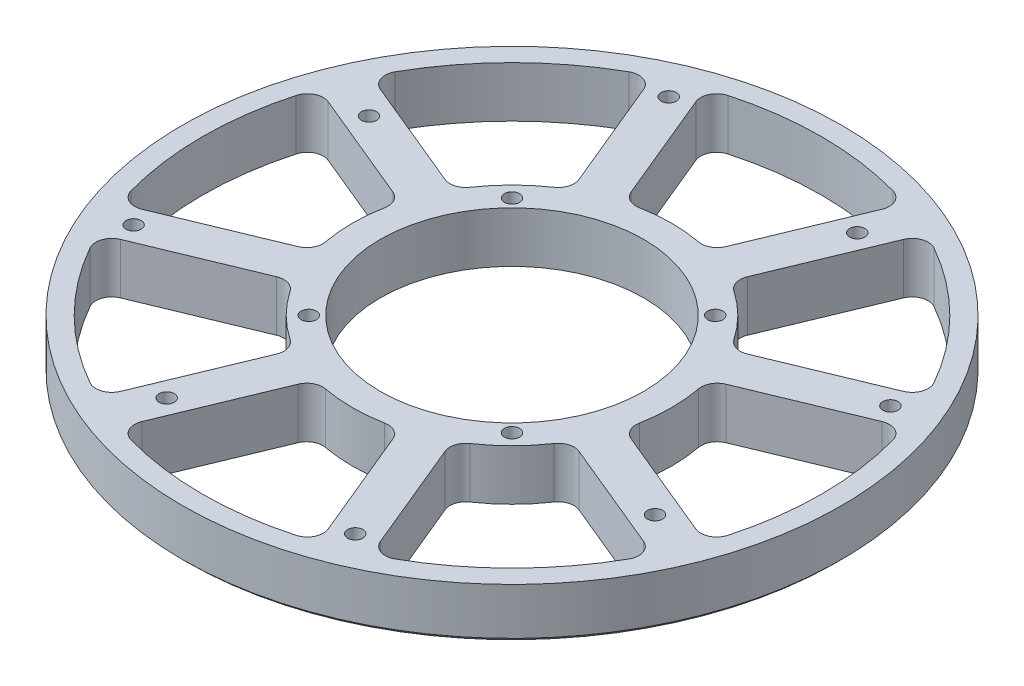
from build123d import *

# Parameters (mm, degrees)
SKETCH2_W                = 82.55
SKETCH2_H                = 12.7
F_10_24_TAPPED_HOLE1_D   = 3.7973
CIRPATTERN3_COUNT        = 4
CUT_EXTRUDE1_DEPTH       = 118.432086757
FILLET1_R                = 4
CIRPATTERN4_COUNT        = 8
FILLET1_OF_CIRPATTERN4_R = 4
CHAMFER2_SIZE            = 1
SKETCH9_R                = 33
CUT_EXTRUDE2_DEPTH       = 118.432086757


with BuildPart() as part:
    # Sketch2 → Revolve1 (revolve)
    with BuildSketch(Plane(origin=(0, 0, 0), x_dir=(0, 0, -1), z_dir=(1, 0, 0))):
        with Locations((-41.275, 6.35)):
            Rectangle(SKETCH2_W, SKETCH2_H)
    revolve(axis=Axis((0, -0.635, 0), (0, 1, 0)))

    # #10-24 Tapped Hole1 (through all)
    with Locations(Plane(origin=(0, 12.7, 0), x_dir=(1, 0, 0), z_dir=(0, 1, 0))):
        with Locations((-27.763683018, 67.027460084), (-61.160825052, 25.333643223), (-25.455844123, 25.455844123)):
            f_10_24_tapped_hole1 = Hole(F_10_24_TAPPED_HOLE1_D / 2)

    # CirPattern3: #10-24 Tapped Hole1 ×4 about axis
    cirpattern3_axis = Axis((0, -0.635, 0), (0, 1, 0))
    for i in range(1, CIRPATTERN3_COUNT):
        add(f_10_24_tapped_hole1.rotate(cirpattern3_axis, i * 360 / CIRPATTERN3_COUNT), mode=Mode.SUBTRACT)

    # Sketch8 → Cut-Extrude1 (cut, through all)
    with BuildSketch(Plane(origin=(0, 12.7, 0), x_dir=(1, 0, 0), z_dir=(0, 1, 0))):
        with BuildLine():
            Line((-10.567880231, 38.578749428), (-24.995954941, 73.411203073))
            ThreePointArc((-24.995954941, 73.411203073), (0, 77.55), (24.995954941, 73.411203073))
            Line((24.995954941, 73.411203073), (10.567880231, 38.578749428))
            ThreePointArc((10.567880231, 38.578749428), (0, 40), (-10.567880231, 38.578749428))
        make_face()
    cut_extrude1 = extrude(amount=-CUT_EXTRUDE1_DEPTH, mode=Mode.SUBTRACT)

    # Fillet1
    fillet1_edges = [part.edges().sort_by_distance(p)[0] for p in [
        (10.567880231, 6.35, -38.578749428),
        (24.995954941, 6.35, -73.411203073),
        (-10.567880231, 6.35, -38.578749428),
        (-24.995954941, 6.35, -73.411203073),
    ]]
    fillet(fillet1_edges, radius=FILLET1_R)

    # CirPattern4: Cut-Extrude1 ×8 about axis
    cirpattern4_axis = Axis((0, -0.635, 0), (0, 1, 0))
    for i in range(1, CIRPATTERN4_COUNT):
        add(cut_extrude1.rotate(cirpattern4_axis, i * 360 / CIRPATTERN4_COUNT), mode=Mode.SUBTRACT)

    # Fillet1 of CirPattern4
    fillet1_of_cirpattern4_edges = [part.edges().sort_by_distance(p)[0] for p in [
        (-19.806675556, 6.35, -34.751915104),
        (-34.234750266, 6.35, -69.584368749),
        (-34.751915104, 6.35, -19.806675556),
        (-69.584368749, 6.35, -34.234750266),
        (-38.578749428, 6.35, -10.567880231),
        (-73.411203073, 6.35, -24.995954941),
        (-38.578749428, 6.35, 10.567880231),
        (-73.411203073, 6.35, 24.995954941),
        (-34.751915104, 6.35, 19.806675556),
        (-69.584368749, 6.35, 34.234750266),
        (-19.806675556, 6.35, 34.751915104),
        (-34.234750266, 6.35, 69.584368749),
        (-10.567880231, 6.35, 38.578749428),
        (-24.995954941, 6.35, 73.411203073),
        (10.567880231, 6.35, 38.578749428),
        (24.995954941, 6.35, 73.411203073),
        (19.806675556, 6.35, 34.751915104),
        (34.234750266, 6.35, 69.584368749),
        (34.751915104, 6.35, 19.806675556),
        (69.584368749, 6.35, 34.234750266),
        (38.578749428, 6.35, 10.567880231),
        (73.411203073, 6.35, 24.995954941),
        (38.578749428, 6.35, -10.567880231),
        (73.411203073, 6.35, -24.995954941),
        (34.751915104, 6.35, -19.806675556),
        (69.584368749, 6.35, -34.234750266),
        (19.806675556, 6.35, -34.751915104),
        (34.234750266, 6.35, -69.584368749),
    ]]
    fillet(fillet1_of_cirpattern4_edges, radius=FILLET1_OF_CIRPATTERN4_R)

    # Chamfer2
    chamfer2_edges = [part.edges().sort_by_distance(p)[0] for p in [
        (0, 0, -82.55),
    ]]
    chamfer(chamfer2_edges, length=CHAMFER2_SIZE)

    # Sketch9 → Cut-Extrude2 (cut, through all)
    with BuildSketch(Plane(origin=(0, 12.7, 0), x_dir=(1, 0, 0), z_dir=(0, 1, 0))):
        Circle(SKETCH9_R)
    extrude(amount=-CUT_EXTRUDE2_DEPTH, mode=Mode.SUBTRACT)


solid = part.part
